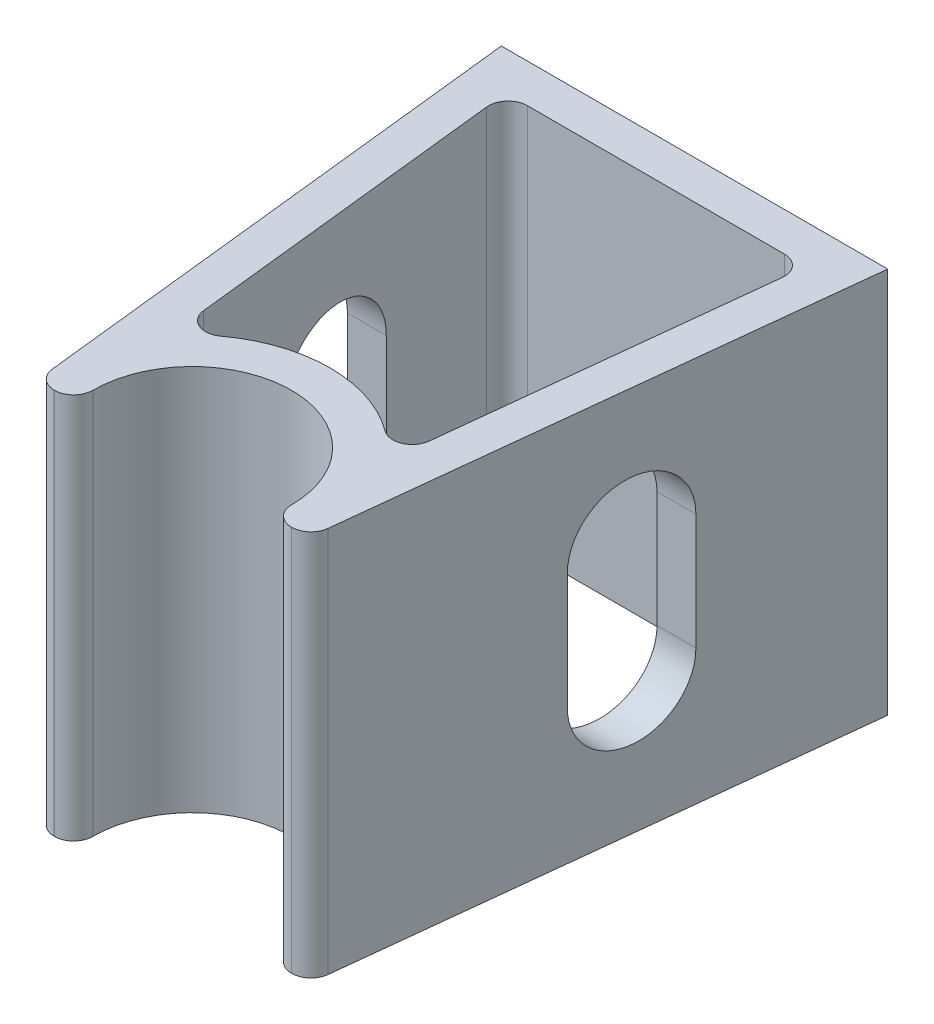
from build123d import *

# Parameters (mm, degrees)
BOSS_EXTRUDE1_DEPTH     = 50
CUT_EXTRUDE1_DEPTH      = 86.732140997
CUT_EXTRUDE1_DEPTH_BACK = 86.732140997
FILLET2_R               = 2.5
CUT_EXTRUDE2_DEPTH      = 86.732140997
CUT_EXTRUDE2_DEPTH_BACK = 86.732140997
SKETCH4_W               = 0.314102564
SKETCH4_H               = 2.557692308
SKETCH4_H_2             = 3.58974359
BOSS_EXTRUDE2_DEPTH     = 1


with BuildPart() as part:
    # Sketch1 → Boss-Extrude1 (new body)
    with BuildSketch(Plane(origin=(0, 0, 0), x_dir=(1, 0, 0), z_dir=(0, 1, 0))):
        with BuildLine():
            Line((-12.6, -2.5), (-17.6, -2.5))
            Line((-17.6, -2.5), (-25, 65))
            Line((-25, 65), (25, 65))
            Line((25, 65), (17.6, -2.5))
            Line((17.6, -2.5), (12.6, -2.5))
            ThreePointArc((12.6, -2.5), (0, 12.845621822), (-12.6, -2.5))
        make_face()
    extrude(amount=BOSS_EXTRUDE1_DEPTH)

    # Sketch2 → Cut-Extrude1 (cut, two sides: drawn at the far end of the back side and taken through both)
    with BuildSketch(Plane(origin=(0, 50, 0), x_dir=(1, 0, 0), z_dir=(0, 1, 0)).offset(-CUT_EXTRUDE1_DEPTH_BACK)):
        with BuildLine():
            Line((14.050316299, 11.002491996), (19.421894954, 60))
            Line((19.421894954, 60), (-19.421894954, 60))
            Line((-19.421894954, 60), (-14.050316299, 11.002491996))
            ThreePointArc((-14.050316299, 11.002491996), (0, 17.845621822), (14.050316299, 11.002491996))
        make_face()
    extrude(amount=CUT_EXTRUDE1_DEPTH + CUT_EXTRUDE1_DEPTH_BACK, mode=Mode.SUBTRACT)

    # Fillet2
    fillet2_edges = [part.edges().sort_by_distance(p)[0] for p in [
        (-19.421894954, 25, -60),
        (19.421894954, 25, -60),
        (14.050316299, 25, -11.002491996),
        (-14.050316299, 25, -11.002491996),
        (17.6, 25, 2.5),
        (12.6, 25, 2.5),
        (-17.6, 25, 2.5),
        (-12.6, 25, 2.5),
    ]]
    fillet(fillet2_edges, radius=FILLET2_R)

    # Sketch3 → Cut-Extrude2 (cut, two sides: drawn at the far end of the back side and taken through both)
    with BuildSketch(Plane(origin=(0, 0, 0), x_dir=(0, 0, -1), z_dir=(1, 0, 0)).offset(-CUT_EXTRUDE2_DEPTH_BACK)):
        with BuildLine():
            Line((42.627558228, 32.5), (42.627558228, 17.5))
            ThreePointArc((42.627558228, 17.5), (35.127558228, 10), (27.627558228, 17.5))
            Line((27.627558228, 17.5), (27.627558228, 32.5))
            ThreePointArc((27.627558228, 32.5), (35.127558228, 40), (42.627558228, 32.5))
        make_face()
    extrude(amount=CUT_EXTRUDE2_DEPTH + CUT_EXTRUDE2_DEPTH_BACK, mode=Mode.SUBTRACT)

    # Sketch4 → Boss-Extrude2 (add)
    # profile 1 of 9: a face of its own
    with BuildSketch(Plane(origin=(0, 0, -65), x_dir=(-1, 0, 0), z_dir=(0, 0, -1))):
        Polygon((-5.047944792, 23.059553128), (-4.733842228, 23.059553128), (-4.733842228, 21.726720596), (-3.274807773, 23.059553128), (-2.826790946, 23.059553128), (-4.546642708, 21.489040308), (-2.692175561, 19.559553128), (-3.111446394, 19.559553128), (-4.733842228, 21.248555532), (-4.733842228, 19.559553128), (-5.047944792, 19.559553128), align=None)
    # profile 2 of 9: a face of its own
    with BuildSketch(Plane(origin=(0, 0, -65), x_dir=(-1, 0, 0), z_dir=(0, 0, -1))):
        with BuildLine():
            add(Edge.make_bspline(
                [(-1.030516907, 22.162117231), (-0.982525634, 22.16109534), (-0.888426477, 22.159091661), (-0.750618591, 22.137676695), (-0.619073455, 22.104929331), (-0.493287263, 22.059657769), (-0.374870967, 21.998975818), (-0.262099723, 21.926566527), (-0.155282714, 21.840783934), (-0.091259685, 21.774425865), (-0.058762099, 21.740743032)],
                knots=[0, 0, 0, 0, 1.054011418, 2.066658804, 3.057071809, 4.030435133, 4.997543892, 5.974964718, 6.972108034, 8, 8, 8, 8], degree=3))
            add(Edge.make_bspline(
                [(-0.058762099, 21.740743032), (-0.030780145, 21.708529047), (0.024642235, 21.644724504), (0.095707954, 21.541268891), (0.156929514, 21.434128791), (0.205992475, 21.321881464), (0.244677498, 21.205506793), (0.272143195, 21.084604782), (0.28848013, 20.959442435), (0.290683097, 20.874438597), (0.291798798, 20.831388064)],
                knots=[0, 0, 0, 0, 1.025258237, 2.030674902, 3.01204498, 3.988269485, 4.97094183, 5.956517959, 6.965070386, 8, 8, 8, 8], degree=3))
            add(Edge.make_bspline(
                [(0.291798798, 20.831388064), (0.290817461, 20.788088007), (0.288878292, 20.702525073), (0.270534676, 20.576505708), (0.24200359, 20.454310885), (0.201171752, 20.336452191), (0.148813643, 20.222569364), (0.084922955, 20.113159814), (0.009051338, 20.008007681), (-0.076952659, 19.908005843), (-0.172004535, 19.815839628), (-0.275120683, 19.735511359), (-0.384274717, 19.666689834), (-0.50091807, 19.611253419), (-0.623985557, 19.567543718), (-0.753742625, 19.536843702), (-0.889987696, 19.518282018), (-0.983014917, 19.515898445), (-1.030516907, 19.514681334)],
                knots=[0, 0, 0, 0, 0.998656419, 1.973391657, 2.932242238, 3.890759089, 4.846373663, 5.82037756, 6.809684879, 7.83454468, 8.860553229, 9.859544525, 10.845671541, 11.83227036, 12.833544569, 13.85385346, 14.904124723, 16, 16, 16, 16], degree=3))
            add(Edge.make_bspline(
                [(-1.030516907, 19.514681334), (-1.078251627, 19.51590253), (-1.171742486, 19.518294304), (-1.308468468, 19.536771587), (-1.438458087, 19.56752957), (-1.561686686, 19.611397062), (-1.678831533, 19.666691606), (-1.78861803, 19.735303296), (-1.891817945, 19.815863451), (-1.98688993, 19.907999388), (-2.072888535, 20.008009344), (-2.148761543, 20.113159383), (-2.212651869, 20.222569476), (-2.265010073, 20.336452161), (-2.305841886, 20.454310893), (-2.334372979, 20.576505705), (-2.352716593, 20.702525074), (-2.354655762, 20.788088007), (-2.355637099, 20.831388064)],
                knots=[0, 0, 0, 0, 1.099876186, 2.154163076, 3.173186993, 4.173200201, 5.163417411, 6.152872554, 7.150605724, 8.17532212, 9.198891216, 10.186952605, 11.159729845, 12.11414092, 13.071450619, 14.029093627, 15.002601286, 16, 16, 16, 16], degree=3))
            add(Edge.make_bspline(
                [(-2.355637099, 20.831388064), (-2.354513789, 20.87420461), (-2.352289828, 20.958974013), (-2.335969319, 21.083901073), (-2.308610762, 21.204598462), (-2.269879366, 21.320523938), (-2.220364175, 21.432279374), (-2.160002887, 21.539684205), (-2.088212254, 21.642672006), (-2.033010303, 21.706394086), (-2.005076202, 21.738639667)],
                knots=[0, 0, 0, 0, 1.031353054, 2.041901799, 3.029428768, 4.008703097, 4.981709435, 5.96992636, 6.972712378, 8, 8, 8, 8], degree=3))
            add(Edge.make_bspline(
                [(-2.005076202, 21.738639667), (-1.972627611, 21.772614606), (-1.908811747, 21.839432302), (-1.801463019, 21.924964826), (-1.688969198, 21.9988809), (-1.569244272, 22.058357116), (-1.443561414, 22.105195634), (-1.311342172, 22.137761149), (-1.173066656, 22.159014504), (-1.078507035, 22.161072681), (-1.030516907, 22.162117231)],
                knots=[0, 0, 0, 0, 1.027980169, 2.021703884, 2.998553061, 3.971491411, 4.943284454, 5.930300938, 6.949603206, 8, 8, 8, 8], degree=3))
        make_face()
        with BuildLine():
            add(Edge.make_bspline(
                [(-1.031919151, 21.848014667), (-1.065856762, 21.847050075), (-1.132855891, 21.845145793), (-1.231475475, 21.830661888), (-1.326415629, 21.807714384), (-1.417856473, 21.775110328), (-1.505489646, 21.733011429), (-1.589399048, 21.681303069), (-1.669831488, 21.620670112), (-1.745213552, 21.55120744), (-1.814395864, 21.475328446), (-1.87487384, 21.394480087), (-1.926298947, 21.309973741), (-1.969139106, 21.22172153), (-2.001046294, 21.128829116), (-2.024219316, 21.032348484), (-2.038689557, 20.932083068), (-2.040575935, 20.86392205), (-2.041534535, 20.829284699)],
                knots=[0, 0, 0, 0, 1.021534396, 2.016698045, 2.994645724, 3.958388632, 4.93408049, 5.916473867, 6.921342795, 7.962252576, 8.998418191, 10.008913653, 10.997312074, 11.973003931, 12.956656626, 13.948281152, 14.957379055, 16, 16, 16, 16], degree=3))
            add(Edge.make_bspline(
                [(-2.041534535, 20.829284699), (-2.039927712, 20.784532672), (-2.036738467, 20.695708266), (-2.010803231, 20.564897144), (-1.967416951, 20.439315292), (-1.908829671, 20.319698905), (-1.835423453, 20.209026627), (-1.748936386, 20.110355143), (-1.650296686, 20.025169332), (-1.540680185, 19.954488486), (-1.422325867, 19.89832873), (-1.297069546, 19.858529755), (-1.166428852, 19.832658062), (-1.077148121, 19.830086588), (-1.031919151, 19.828783898)],
                knots=[0, 0, 0, 0, 1.016792936, 2.018143844, 3.017858371, 4.030088057, 5.03801393, 6.028138512, 7.003788237, 7.991172063, 8.984598303, 9.972568034, 10.972917682, 12, 12, 12, 12], degree=3))
            add(Edge.make_bspline(
                [(-1.031919151, 19.828783898), (-0.986692782, 19.830094178), (-0.897417186, 19.832680635), (-0.766958009, 19.858399455), (-0.642044037, 19.898503115), (-0.52381265, 19.954425325), (-0.414246046, 20.02543774), (-0.314896925, 20.109874117), (-0.229148314, 20.209287968), (-0.155814709, 20.319845497), (-0.096267966, 20.439129849), (-0.053084764, 20.564920322), (-0.027087178, 20.695702363), (-0.02390635, 20.784530694), (-0.022303766, 20.829284699)],
                knots=[0, 0, 0, 0, 1.02726834, 2.027799167, 3.010890988, 4.004497153, 4.992059811, 5.971914811, 6.958719428, 7.966827853, 8.981595046, 9.981490638, 10.983022906, 12, 12, 12, 12], degree=3))
            add(Edge.make_bspline(
                [(-0.022303766, 20.829284699), (-0.023262036, 20.863922257), (-0.025147765, 20.932083682), (-0.03962273, 21.032346136), (-0.062778269, 21.128837733), (-0.094749887, 21.221689736), (-0.1374039, 21.31020224), (-0.189820693, 21.394231967), (-0.250051719, 21.475608513), (-0.32006884, 21.550962154), (-0.395372218, 21.620697191), (-0.475837256, 21.68132658), (-0.559622234, 21.732784176), (-0.647000817, 21.775470416), (-0.738453385, 21.807417756), (-0.833260514, 21.830794388), (-0.931459324, 21.845084585), (-0.998218367, 21.847031726), (-1.031919151, 21.848014667)],
                knots=[0, 0, 0, 0, 1.042956736, 2.052379634, 3.044323526, 4.02829302, 5.004299113, 5.996692471, 7.007513377, 8.048758398, 9.090003419, 10.095195979, 11.07790575, 12.047570684, 13.018257071, 13.989683339, 14.985167495, 16, 16, 16, 16], degree=3))
        make_face(mode=Mode.SUBTRACT)
    # profile 3 of 9: a face of its own
    with BuildSketch(Plane(origin=(0, 0, -65), x_dir=(-1, 0, 0), z_dir=(0, 0, -1))):
        with BuildLine():
            Line((3.522568029, 22.117245436), (3.522568029, 19.559553128))
            Line((3.522568029, 19.559553128), (3.208465465, 19.559553128))
            Line((3.208465465, 19.559553128), (3.208465465, 20.001960981))
            add(Edge.make_bspline(
                [(3.208465465, 20.001960981), (3.173046674, 19.961921387), (3.103926459, 19.883783616), (2.988485341, 19.781701443), (2.866117163, 19.697323122), (2.737415842, 19.629173206), (2.602497598, 19.57798115), (2.461661511, 19.541594991), (2.31485013, 19.518201156), (2.214597775, 19.515865134), (2.16379399, 19.514681334)],
                knots=[0, 0, 0, 0, 1.074387032, 2.096679803, 3.090159297, 4.057316773, 5.018401886, 5.985159533, 6.978961417, 8, 8, 8, 8], degree=3))
            add(Edge.make_bspline(
                [(2.16379399, 19.514681334), (2.118626036, 19.515907706), (2.029552832, 19.518326166), (1.898523754, 19.53708847), (1.772431505, 19.567219092), (1.651156932, 19.609119981), (1.535484787, 19.664700803), (1.42442469, 19.731242051), (1.318551998, 19.810482881), (1.219480459, 19.901070909), (1.128248459, 19.999465896), (1.048187186, 20.104411443), (0.981434106, 20.215453747), (0.925614026, 20.331186901), (0.882617681, 20.452501821), (0.852644047, 20.578978988), (0.8339036, 20.710468862), (0.83148614, 20.800008385), (0.830260336, 20.8454105)],
                knots=[0, 0, 0, 0, 1.033919861, 2.038935746, 3.024066025, 3.998881131, 4.97069526, 5.957263378, 6.95902576, 7.993208707, 9.027059324, 10.027763471, 11.009749337, 11.988697705, 12.965288445, 13.950418724, 14.960734635, 16, 16, 16, 16], degree=3))
            add(Edge.make_bspline(
                [(0.830260336, 20.8454105), (0.831513308, 20.889874204), (0.833990365, 20.977776547), (0.852443585, 21.107055245), (0.883474593, 21.231573506), (0.927022441, 21.350930449), (0.982864396, 21.465270499), (1.050792483, 21.574674524), (1.130811608, 21.679443922), (1.223064015, 21.777115149), (1.322998785, 21.867335763), (1.429907516, 21.945744808), (1.541130797, 22.013461657), (1.658393807, 22.067115133), (1.779960912, 22.110524238), (1.906914358, 22.140557206), (2.038725937, 22.158254527), (2.128216429, 22.160817291), (2.173609695, 22.162117231)],
                knots=[0, 0, 0, 0, 1.020392517, 2.01726096, 2.990465484, 3.961182959, 4.928053699, 5.906110375, 6.912531644, 7.948652711, 8.985773172, 9.998621852, 10.987621588, 11.969261332, 12.953316658, 13.946091881, 14.958173133, 16, 16, 16, 16], degree=3))
            add(Edge.make_bspline(
                [(2.173609695, 22.162117231), (2.225809554, 22.160679479), (2.328171014, 22.157860117), (2.477899024, 22.134397389), (2.619543502, 22.094758922), (2.754197854, 22.040841424), (2.88137854, 21.969192695), (2.999881524, 21.878812734), (3.110947007, 21.770271547), (3.175327299, 21.686901103), (3.208465465, 21.643988225)],
                knots=[0, 0, 0, 0, 1.038897134, 2.037228247, 3.008116434, 3.962042015, 4.918381754, 5.904844433, 6.921570401, 8, 8, 8, 8], degree=3))
            Line((3.208465465, 21.643988225), (3.208465465, 22.117245436))
            Line((3.208465465, 22.117245436), (3.522568029, 22.117245436))
        make_face()
        with BuildLine():
            add(Edge.make_bspline(
                [(2.177816426, 21.848014667), (2.131902088, 21.846381029), (2.041274488, 21.843156488), (1.908230486, 21.817982993), (1.780917072, 21.776098399), (1.659970998, 21.718816497), (1.547302781, 21.646787761), (1.44660911, 21.559666378), (1.357066409, 21.459829363), (1.281758145, 21.347727253), (1.220367648, 21.227549162), (1.177200616, 21.101924724), (1.148731369, 20.973119746), (1.145822848, 20.88575706), (1.144362901, 20.841904891)],
                knots=[0, 0, 0, 0, 1.031046209, 2.035121221, 3.029706178, 4.034933723, 5.034054252, 6.02443088, 7.017295772, 8.038157696, 9.050218397, 10.03989886, 11.016116709, 12, 12, 12, 12], degree=3))
            add(Edge.make_bspline(
                [(1.144362901, 20.841904891), (1.146227794, 20.798314784), (1.149950271, 20.711305428), (1.176700965, 20.582324851), (1.221580839, 20.456670809), (1.282822901, 20.335409816), (1.359509526, 20.222825716), (1.448398179, 20.121085593), (1.55034846, 20.033596005), (1.663275967, 19.960358431), (1.783883937, 19.90119591), (1.910717869, 19.860030271), (2.041393507, 19.83345249), (2.130245841, 19.830348013), (2.175011939, 19.828783898)],
                knots=[0, 0, 0, 0, 0.979072187, 1.954306742, 2.945804271, 3.96968567, 4.997920485, 5.998718438, 6.996577872, 8.005894225, 9.015743152, 10.005417472, 10.995077863, 12, 12, 12, 12], degree=3))
            add(Edge.make_bspline(
                [(2.175011939, 19.828783898), (2.220458442, 19.830443862), (2.310847028, 19.833745365), (2.444285736, 19.859026631), (2.573780699, 19.900795429), (2.697567927, 19.958694556), (2.812884058, 20.030451911), (2.916381936, 20.114459003), (3.003897904, 20.212162187), (3.078090514, 20.31953864), (3.136265931, 20.437250636), (3.17864199, 20.562584827), (3.203695896, 20.695545575), (3.206853625, 20.786409502), (3.208465465, 20.832790308)],
                knots=[0, 0, 0, 0, 1.01762866, 2.023962475, 3.030623092, 4.058876274, 5.077231937, 6.066672613, 7.034107872, 8.005628644, 8.981990164, 9.965428785, 10.961468474, 12, 12, 12, 12], degree=3))
            add(Edge.make_bspline(
                [(3.208465465, 20.832790308), (3.207505808, 20.868128138), (3.205616901, 20.937684172), (3.191186331, 21.039811689), (3.168231405, 21.137545415), (3.135885235, 21.230988104), (3.09339395, 21.31962312), (3.042146185, 21.40408688), (2.981240735, 21.483940091), (2.911658039, 21.558083162), (2.835492836, 21.625709625), (2.754898296, 21.686073865), (2.668919549, 21.735662638), (2.579002512, 21.77670391), (2.484991177, 21.80936306), (2.386120557, 21.831150753), (2.28344157, 21.846111074), (2.213395515, 21.847373455), (2.177816426, 21.848014667)],
                knots=[0, 0, 0, 0, 1.050140795, 2.067009409, 3.05949893, 4.030605086, 5.00011959, 5.97591094, 6.962425594, 7.979863591, 8.993523472, 9.986985069, 10.967611495, 11.937549037, 12.921786183, 13.919465291, 14.943216303, 16, 16, 16, 16], degree=3))
        make_face(mode=Mode.SUBTRACT)
    # profile 4 of 9: a face of its own
    with BuildSketch(Plane(origin=(0, 0, -65), x_dir=(-1, 0, 0), z_dir=(0, 0, -1))):
        Polygon((5.676414183, 23.059553128), (5.990516747, 23.059553128), (5.990516747, 19.918527487), (7.336670593, 19.918527487), (7.336670593, 19.559553128), (5.676414183, 19.559553128), align=None)
    # profile 5 of 9: a face of its own
    with BuildSketch(Plane(origin=(0, 0, -65), x_dir=(-1, 0, 0), z_dir=(0, 0, -1))):
        with BuildLine():
            add(Edge.make_bspline(
                [(7.94103758, 23.194168513), (7.960528896, 23.193264361), (7.998696636, 23.191493857), (8.053889903, 23.17633238), (8.104146915, 23.150632694), (8.148724648, 23.116153013), (8.186976535, 23.07560357), (8.213757245, 23.028342601), (8.230969641, 22.977283963), (8.233048197, 22.941668873), (8.23410649, 22.9235355)],
                knots=[0, 0, 0, 0, 1.055194115, 2.066272739, 3.074728998, 4.095836921, 5.109056067, 6.073838105, 7.019297344, 8, 8, 8, 8], degree=3))
            add(Edge.make_bspline(
                [(8.23410649, 22.9235355), (8.23302433, 22.905872847), (8.230885029, 22.870955872), (8.21377054, 22.8207824), (8.186748302, 22.774178117), (8.148749177, 22.733707406), (8.104140416, 22.699246786), (8.05389163, 22.673542047), (7.998696181, 22.65838191), (7.960528742, 22.656611221), (7.94103758, 22.655706975)],
                knots=[0, 0, 0, 0, 0.96129708, 1.900370562, 2.859976407, 3.87933698, 4.906634145, 5.921202961, 6.938410037, 8, 8, 8, 8], degree=3))
            add(Edge.make_bspline(
                [(7.94103758, 22.655706975), (7.921769305, 22.656576695), (7.884266125, 22.658269492), (7.829899282, 22.673839509), (7.780070793, 22.699255582), (7.73540612, 22.733481768), (7.698175927, 22.774426665), (7.671077602, 22.820753959), (7.65400264, 22.870963113), (7.651858011, 22.90587528), (7.650773157, 22.9235355)],
                knots=[0, 0, 0, 0, 1.054934014, 2.053291228, 3.073705704, 4.106921865, 5.123545215, 6.088680038, 7.033164197, 8, 8, 8, 8], degree=3))
            add(Edge.make_bspline(
                [(7.650773157, 22.9235355), (7.651834244, 22.94166635), (7.653918285, 22.977276482), (7.671090401, 23.028371515), (7.697950209, 23.075353017), (7.735430772, 23.116378517), (7.780064232, 23.150623951), (7.829900978, 23.176034933), (7.884265677, 23.191606272), (7.921769153, 23.193298887), (7.94103758, 23.194168513)],
                knots=[0, 0, 0, 0, 0.98631895, 1.937192651, 2.907499808, 3.917963147, 4.944918757, 5.95915025, 6.951458133, 8, 8, 8, 8], degree=3))
        make_face()
    # profile 6 of 9: a face of its own
    with BuildSketch(Plane(origin=(0, 0, -65), x_dir=(-1, 0, 0), z_dir=(0, 0, -1))):
        with Locations((7.942439824, 20.838399282)):
            Rectangle(SKETCH4_W, SKETCH4_H)
    # profile 7 of 9: a face of its own
    with BuildSketch(Plane(origin=(0, 0, -65), x_dir=(-1, 0, 0), z_dir=(0, 0, -1))):
        with Locations((8.974491106, 21.354424923)):
            Rectangle(SKETCH4_W, SKETCH4_H_2)
    # profile 8 of 9: a face of its own
    with BuildSketch(Plane(origin=(0, 0, -65), x_dir=(-1, 0, 0), z_dir=(0, 0, -1))):
        with BuildLine():
            Line((11.94864976, 20.367245436), (12.227696234, 20.220710981))
            add(Edge.make_bspline(
                [(12.227696234, 20.220710981), (12.205459639, 20.18126765), (12.16219603, 20.104526547), (12.087795282, 19.999094686), (12.00980321, 19.904246971), (11.924699242, 19.822517316), (11.835029563, 19.751265931), (11.740296908, 19.688928107), (11.64000809, 19.635809586), (11.534158365, 19.591057058), (11.421858814, 19.556647564), (11.302837298, 19.532343343), (11.176865802, 19.517320075), (11.090519623, 19.515574934), (11.04630601, 19.514681334)],
                knots=[0, 0, 0, 0, 1.120438281, 2.179929193, 3.190490725, 4.156257408, 5.095198341, 6.022838206, 6.959905092, 7.901321166, 8.864066838, 9.862729781, 10.905609505, 12, 12, 12, 12], degree=3))
            add(Edge.make_bspline(
                [(11.04630601, 19.514681334), (10.997164032, 19.515828509), (10.90130227, 19.518066316), (10.761762523, 19.53735878), (10.630383105, 19.568831139), (10.507171401, 19.61279668), (10.392429149, 19.670224004), (10.285928294, 19.740183486), (10.187108768, 19.822315741), (10.099084559, 19.917332184), (10.019840676, 20.019014142), (9.949914856, 20.124970026), (9.891457425, 20.234933251), (9.843904815, 20.348203775), (9.80549995, 20.464067668), (9.778733246, 20.583579136), (9.763303498, 20.70641472), (9.760939053, 20.789512056), (9.759747516, 20.831388064)],
                knots=[0, 0, 0, 0, 1.145258523, 2.234067595, 3.276747158, 4.290159414, 5.277019952, 6.260822364, 7.254936242, 8.264827045, 9.274100331, 10.257902744, 11.220704747, 12.172965371, 13.118907548, 14.062713208, 15.023725156, 16, 16, 16, 16], degree=3))
            add(Edge.make_bspline(
                [(9.759747516, 20.831388064), (9.760806657, 20.870682895), (9.762905736, 20.948560059), (9.776136523, 21.063825604), (9.799584816, 21.175854057), (9.83176114, 21.284738504), (9.873312386, 21.390296638), (9.924144605, 21.492592702), (9.984336983, 21.591517842), (10.030809657, 21.653920976), (10.05421867, 21.685354411)],
                knots=[0, 0, 0, 0, 1.024358464, 2.0301432, 3.019427413, 4.004406732, 4.986367066, 5.972626655, 6.978780325, 8, 8, 8, 8], degree=3))
            add(Edge.make_bspline(
                [(10.05421867, 21.685354411), (10.085926353, 21.723223281), (10.148337299, 21.797761431), (10.253893655, 21.895699757), (10.368193851, 21.977743532), (10.489805477, 22.045750668), (10.620141951, 22.097424315), (10.757451242, 22.135931897), (10.903296828, 22.157509908), (11.003002049, 22.160557742), (11.054018349, 22.162117231)],
                knots=[0, 0, 0, 0, 1.030682036, 2.02871468, 2.997146059, 3.962720338, 4.930598197, 5.918074684, 6.934738563, 8, 8, 8, 8], degree=3))
            add(Edge.make_bspline(
                [(11.054018349, 22.162117231), (11.106465955, 22.160763182), (11.209356201, 22.158106847), (11.359388322, 22.133480513), (11.501349038, 22.094427959), (11.635181542, 22.039274168), (11.760899403, 21.968114617), (11.877685453, 21.879972775), (11.987536965, 21.777554688), (12.051445544, 21.698791478), (12.083966266, 21.658711782)],
                knots=[0, 0, 0, 0, 1.056321875, 2.072262726, 3.055038591, 4.01806755, 4.982017516, 5.957941055, 6.960871419, 8, 8, 8, 8], degree=3))
            add(Edge.make_bspline(
                [(12.083966266, 21.658711782), (12.106093204, 21.628508201), (12.150199797, 21.568302082), (12.205446897, 21.470130925), (12.253404292, 21.367420331), (12.291737253, 21.258510034), (12.322776755, 21.144690454), (12.345233573, 21.025147909), (12.358403192, 20.899917997), (12.360991889, 20.814591442), (12.362311618, 20.77109159)],
                knots=[0, 0, 0, 0, 0.94817472, 1.890038105, 2.849395472, 3.817997239, 4.812318967, 5.836947057, 6.897266129, 8, 8, 8, 8], degree=3))
            Line((12.362311618, 20.77109159), (10.07385008, 20.77109159))
            add(Edge.make_bspline(
                [(10.07385008, 20.77109159), (10.075389686, 20.737391126), (10.07841726, 20.671120522), (10.092532404, 20.574149739), (10.114781177, 20.481776397), (10.14605024, 20.394693355), (10.183917085, 20.311763227), (10.230302802, 20.23360119), (10.285642356, 20.16056326), (10.347368055, 20.091996123), (10.416075151, 20.030935361), (10.488357898, 19.976283585), (10.565251463, 19.930477989), (10.646149546, 19.893298099), (10.730921332, 19.864191783), (10.819593527, 19.844323962), (10.911991643, 19.831016855), (10.974977377, 19.82953719), (11.007043189, 19.828783898)],
                knots=[0, 0, 0, 0, 1.094153842, 2.151609401, 3.174256925, 4.172055639, 5.149267565, 6.128595816, 7.11444997, 8.118368179, 9.117203808, 10.09244225, 11.054858984, 12.015122123, 12.976791628, 13.957293641, 14.960065497, 16, 16, 16, 16], degree=3))
            add(Edge.make_bspline(
                [(11.007043189, 19.828783898), (11.038394337, 19.829391954), (11.100601028, 19.830598455), (11.193241885, 19.842330366), (11.284381412, 19.861300642), (11.373642396, 19.887190632), (11.459213241, 19.918767484), (11.538458792, 19.956870342), (11.611339007, 19.999020089), (11.679455974, 20.047229764), (11.745526967, 20.106237951), (11.811069454, 20.179873672), (11.881346107, 20.266961199), (11.9253357, 20.332506865), (11.94864976, 20.367245436)],
                knots=[0, 0, 0, 0, 0.99110716, 1.966546729, 2.947904876, 3.932708344, 4.903319531, 5.828989031, 6.710028674, 7.56322171, 8.463672341, 9.504779593, 10.677557249, 12, 12, 12, 12], degree=3))
        make_face()
        with BuildLine():
            add(Edge.make_bspline(
                [(12.048209054, 21.085194154), (12.03671243, 21.126857028), (12.014585128, 21.207044648), (11.968348764, 21.318085539), (11.916277223, 21.41677344), (11.854655492, 21.502353073), (11.784836766, 21.578356586), (11.704191584, 21.644775171), (11.61375569, 21.704192622), (11.513996549, 21.754345122), (11.408354764, 21.79703498), (11.297748572, 21.825660096), (11.184890784, 21.845269638), (11.108556498, 21.847095747), (11.070144151, 21.848014667)],
                knots=[0, 0, 0, 0, 1.154881502, 2.222775134, 3.210006277, 4.132804581, 5.035138423, 5.962687519, 6.919655026, 7.923214229, 8.944639381, 9.960483929, 10.97369054, 12, 12, 12, 12], degree=3))
            add(Edge.make_bspline(
                [(11.070144151, 21.848014667), (11.038794712, 21.847402995), (10.976823463, 21.846193849), (10.885522395, 21.83472372), (10.797842696, 21.815763875), (10.713137408, 21.789798919), (10.63251654, 21.755190316), (10.554321772, 21.714607089), (10.480541375, 21.665065506), (10.43440008, 21.627306651), (10.411089663, 21.608231013)],
                knots=[0, 0, 0, 0, 1.04873581, 2.073130211, 3.073294108, 4.04793562, 5.032784715, 6.005352987, 6.992311501, 8, 8, 8, 8], degree=3))
            add(Edge.make_bspline(
                [(10.411089663, 21.608231013), (10.394396381, 21.593136697), (10.360613247, 21.562589481), (10.315472726, 21.509960275), (10.272252253, 21.453208713), (10.2329186, 21.390163588), (10.196841014, 21.321542809), (10.163081037, 21.247925174), (10.132694625, 21.168752044), (10.115598514, 21.113579604), (10.106802804, 21.085194154)],
                knots=[0, 0, 0, 0, 0.879870761, 1.780643979, 2.707998968, 3.669668524, 4.684282772, 5.740141944, 6.837334558, 8, 8, 8, 8], degree=3))
            Line((10.106802804, 21.085194154), (12.048209054, 21.085194154))
        make_face(mode=Mode.SUBTRACT)
    # profile 9 of 9: a face of its own
    with BuildSketch(Plane(origin=(0, 0, -65), x_dir=(-1, 0, 0), z_dir=(0, 0, -1))):
        with BuildLine():
            Line((14.202055208, 21.798235019), (13.988914183, 21.578783898))
            add(Edge.make_bspline(
                [(13.988914183, 21.578783898), (13.970523679, 21.600097044), (13.935068953, 21.641186281), (13.878837472, 21.696123348), (13.822813869, 21.742260287), (13.767765055, 21.781212545), (13.712306786, 21.810661692), (13.657089868, 21.832156554), (13.602057129, 21.84545836), (13.565271094, 21.847172798), (13.547207452, 21.848014667)],
                knots=[0, 0, 0, 0, 1.26578478, 2.440284043, 3.530471711, 4.527705817, 5.468200915, 6.346673037, 7.188140097, 8, 8, 8, 8], degree=3))
            add(Edge.make_bspline(
                [(13.547207452, 21.848014667), (13.525068062, 21.846939794), (13.481500876, 21.844824596), (13.419075058, 21.823711166), (13.361124433, 21.791302427), (13.310967453, 21.745333844), (13.268479773, 21.692569575), (13.237466092, 21.63357325), (13.218500108, 21.570125206), (13.216095376, 21.526095349), (13.214875721, 21.503763866)],
                knots=[0, 0, 0, 0, 0.99966794, 1.967205029, 2.953328237, 3.988086729, 5.028030931, 6.008226631, 6.989793394, 8, 8, 8, 8], degree=3))
            add(Edge.make_bspline(
                [(13.214875721, 21.503763866), (13.215986533, 21.483551821), (13.218205026, 21.443184711), (13.235451706, 21.383636677), (13.262917778, 21.325579639), (13.288587972, 21.290016732), (13.301814824, 21.271692552)],
                knots=[0, 0, 0, 0, 0.960159726, 1.917612774, 2.927026955, 4, 4, 4, 4], degree=3))
            add(Edge.make_bspline(
                [(13.301814824, 21.271692552), (13.309778317, 21.261907967), (13.32672761, 21.241082713), (13.358536125, 21.212178859), (13.394558628, 21.180236608), (13.437878566, 21.148299771), (13.486629594, 21.114668046), (13.541868878, 21.080665913), (13.601843383, 21.043701488), (13.644780689, 21.020257053), (13.667099279, 21.008070757)],
                knots=[0, 0, 0, 0, 0.66740084, 1.420478572, 2.27185888, 3.217733974, 4.268547843, 5.408967954, 6.65319498, 8, 8, 8, 8], degree=3))
            add(Edge.make_bspline(
                [(13.667099279, 21.008070757), (13.694312856, 20.992825854), (13.746880526, 20.963377721), (13.821573293, 20.917668018), (13.889360334, 20.872236594), (13.950816002, 20.82756932), (14.004757811, 20.782416452), (14.052822363, 20.738508695), (14.093810807, 20.694519387), (14.116764734, 20.663786273), (14.127736298, 20.649096398)],
                knots=[0, 0, 0, 0, 1.27191281, 2.456916733, 3.569705269, 4.599008579, 5.553216877, 6.436649441, 7.252746552, 8, 8, 8, 8], degree=3))
            add(Edge.make_bspline(
                [(14.127736298, 20.649096398), (14.145946825, 20.61943031), (14.182189155, 20.560389289), (14.220247421, 20.463170861), (14.242307696, 20.360060359), (14.245369916, 20.289528139), (14.246927003, 20.253663705)],
                knots=[0, 0, 0, 0, 0.995354457, 1.980940102, 2.973342416, 4, 4, 4, 4], degree=3))
            add(Edge.make_bspline(
                [(14.246927003, 20.253663705), (14.246207469, 20.228394559), (14.244789549, 20.178598946), (14.234931482, 20.105264116), (14.217976506, 20.035129559), (14.194882752, 19.967434274), (14.163698379, 19.903475334), (14.127150582, 19.841639085), (14.08327567, 19.783263155), (14.033184295, 19.728424195), (13.978338801, 19.678338447), (13.919832662, 19.634314493), (13.857593832, 19.597740156), (13.79206703, 19.567474811), (13.723103376, 19.543406553), (13.650692087, 19.526744022), (13.575063332, 19.51677126), (13.523633524, 19.515386784), (13.497427804, 19.514681334)],
                knots=[0, 0, 0, 0, 1.032770009, 2.035186124, 3.017557409, 3.978232242, 4.952395191, 5.920591857, 6.910227898, 7.931268572, 8.952309245, 9.941945286, 10.918353717, 11.897095711, 12.887975737, 13.898235213, 14.929059601, 16, 16, 16, 16], degree=3))
            add(Edge.make_bspline(
                [(13.497427804, 19.514681334), (13.462060629, 19.515674034), (13.391817702, 19.517645641), (13.287927983, 19.536151702), (13.186407224, 19.564947096), (13.088023684, 19.60466303), (12.99497757, 19.654813743), (12.909846645, 19.714876137), (12.832335183, 19.782866134), (12.788216909, 19.834979045), (12.766157772, 19.8610355)],
                knots=[0, 0, 0, 0, 1.013940152, 2.01379169, 3.017749504, 4.037548394, 5.051665909, 6.043208538, 7.021604269, 8, 8, 8, 8], degree=3))
            Line((12.766157772, 19.8610355), (12.974390945, 20.098014667))
            add(Edge.make_bspline(
                [(12.974390945, 20.098014667), (12.994163358, 20.076659902), (13.032495171, 20.035260462), (13.093796387, 19.980136122), (13.156175789, 19.933934851), (13.219010475, 19.895291436), (13.283230569, 19.865516033), (13.348476184, 19.844597439), (13.414614608, 19.831153247), (13.459036744, 19.829574964), (13.481302003, 19.828783898)],
                knots=[0, 0, 0, 0, 1.179806542, 2.287233372, 3.337373186, 4.324005949, 5.273901747, 6.200048787, 7.097828587, 8, 8, 8, 8], degree=3))
            add(Edge.make_bspline(
                [(13.481302003, 19.828783898), (13.511619929, 19.830154723), (13.570856071, 19.832833084), (13.655699829, 19.857150176), (13.734038456, 19.895280128), (13.802061801, 19.949364826), (13.859963962, 20.012320399), (13.901892137, 20.083234518), (13.928168312, 20.160025975), (13.931254311, 20.213258278), (13.932824439, 20.240342391)],
                knots=[0, 0, 0, 0, 1.072336372, 2.095165389, 3.102688358, 4.141489647, 5.156069229, 6.117746104, 7.042326257, 8, 8, 8, 8], degree=3))
            add(Edge.make_bspline(
                [(13.932824439, 20.240342391), (13.931738145, 20.26265201), (13.929593402, 20.306699366), (13.91275013, 20.370449707), (13.886137278, 20.430918987), (13.859932629, 20.466308635), (13.846586458, 20.484332776)],
                knots=[0, 0, 0, 0, 1.013901739, 2.00181326, 2.98231254, 4, 4, 4, 4], degree=3))
            add(Edge.make_bspline(
                [(13.846586458, 20.484332776), (13.838564064, 20.493368138), (13.821088391, 20.51305042), (13.78903315, 20.541475499), (13.750651288, 20.572113598), (13.705511125, 20.604445187), (13.653521663, 20.638043792), (13.594472188, 20.672733145), (13.529171635, 20.71016087), (13.483001004, 20.734980526), (13.458866106, 20.747954571)],
                knots=[0, 0, 0, 0, 0.615000592, 1.339693406, 2.178160186, 3.116406724, 4.166410947, 5.330106347, 6.604359322, 8, 8, 8, 8], degree=3))
            add(Edge.make_bspline(
                [(13.458866106, 20.747954571), (13.432819466, 20.762493702), (13.382306718, 20.790689719), (13.310759427, 20.834605799), (13.246212073, 20.879273074), (13.187111498, 20.922185913), (13.134950493, 20.965606857), (13.089934544, 21.009584108), (13.050291329, 21.052344094), (13.028343917, 21.082641391), (13.017860497, 21.097113225)],
                knots=[0, 0, 0, 0, 1.262093308, 2.447601706, 3.550203992, 4.582594899, 5.537233252, 6.418365656, 7.244515135, 8, 8, 8, 8], degree=3))
            add(Edge.make_bspline(
                [(13.017860497, 21.097113225), (12.999729897, 21.12625884), (12.963462362, 21.184560255), (12.928247171, 21.281870732), (12.904041142, 21.384315789), (12.901878752, 21.455002643), (12.900773157, 21.491143673)],
                knots=[0, 0, 0, 0, 0.985009483, 1.970363186, 2.962279964, 4, 4, 4, 4], degree=3))
            add(Edge.make_bspline(
                [(12.900773157, 21.491143673), (12.901307352, 21.514769071), (12.902352848, 21.561007322), (12.9106969, 21.628946143), (12.925888611, 21.693494296), (12.944943534, 21.755621159), (12.971426538, 21.814123253), (13.003072443, 21.869780724), (13.040259868, 21.922516642), (13.083103159, 21.971519775), (13.130209804, 22.016029101), (13.181104574, 22.054827729), (13.234642831, 22.087934084), (13.29105125, 22.115699244), (13.350871723, 22.136700627), (13.413686109, 22.151158012), (13.479367264, 22.160813215), (13.52426839, 22.161676299), (13.547207452, 22.162117231)],
                knots=[0, 0, 0, 0, 1.087655834, 2.128696564, 3.144119009, 4.137814668, 5.115653402, 6.093965665, 7.082169637, 8.081268856, 9.086088321, 10.061021666, 11.022561449, 11.980240094, 12.950172527, 13.934149372, 14.944599409, 16, 16, 16, 16], degree=3))
            add(Edge.make_bspline(
                [(13.547207452, 22.162117231), (13.574399515, 22.16101289), (13.629293737, 22.158783493), (13.711648363, 22.141077802), (13.793881705, 22.111944698), (13.876205055, 22.071708465), (13.958015345, 22.019641589), (14.040032201, 21.956712289), (14.123240232, 21.883334575), (14.175196545, 21.827235349), (14.202055208, 21.798235019)],
                knots=[0, 0, 0, 0, 0.845714091, 1.707292901, 2.609013841, 3.555613372, 4.552488639, 5.621697636, 6.770543573, 8, 8, 8, 8], degree=3))
        make_face()
    extrude(amount=BOSS_EXTRUDE2_DEPTH)


solid = part.part
